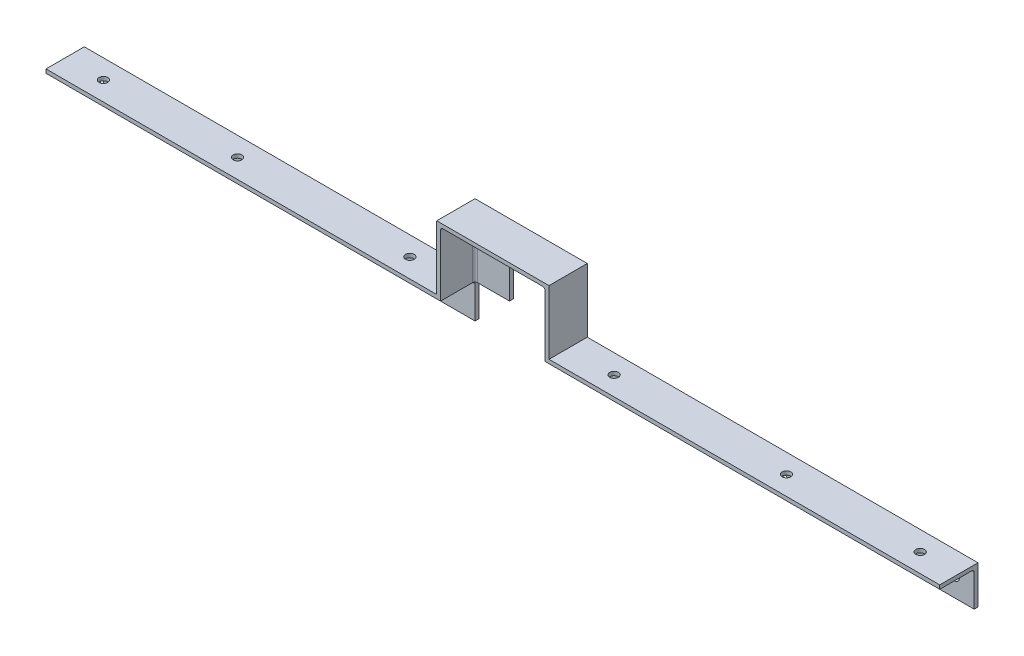
from build123d import *

# Parameters (mm, degrees)
BOSS_EXTRU_1_DEPTH      = 1.5
BOSS_EXTRU_2_DEPTH      = 13.5
D_GAGEMENT_M32_D        = 3.4
D_GAGEMENT_M32_DEPTH    = 10
D_GAGEMENT_M32_TIP      = 1.021463052
D_GAGEMENT_M31_D        = 3.4
D_GAGEMENT_M31_DEPTH    = 10
D_GAGEMENT_M31_TIP      = 1.021463052
ESQUISSE12_W            = 13.5
ESQUISSE12_H            = 13.5
ENL_V_MAT_EXTRU_1_DEPTH = 1.5
CONG_1_R                = 1
CONG_2_R                = 1
D_GAGEMENT_M33_D        = 3.4
D_GAGEMENT_M33_DEPTH    = 10
D_GAGEMENT_M33_TIP      = 1.021463052


# Some blends are built 0.0001 mm under size
with BuildPart() as part:
    # Esquisse2 → Boss.-Extru.1 (new body)
    with BuildSketch(Plane.XY.offset(1.5)):
        Polygon((-25.392437762, 124.305889048), (-178.410591433, 124.305889048), (-178.410591433, 149.305889048), (-222.374284091, 149.305889048), (-222.374284091, 124.305889048), (-375.392437762, 124.305889048), (-375.392437762, 109.305889048), (-207.374284091, 109.305889048), (-207.374284091, 134.305889048), (-193.410591433, 134.305889048), (-193.410591433, 109.305889048), (-25.392437762, 109.305889048), align=None)
    extrude(amount=BOSS_EXTRU_1_DEPTH)

    # Esquisse3 → Boss.-Extru.2 (add)
    with BuildSketch(Plane.XY.offset(3)):
        Polygon((-375.392437762, 122.805889048), (-220.874284091, 122.805889048), (-220.874284091, 147.805889048), (-179.910591433, 147.805889048), (-179.910591433, 122.805889048), (-25.392437762, 122.805889048), (-25.392437762, 124.305889048), (-178.410591433, 124.305889048), (-178.410591433, 149.305889048), (-222.374284091, 149.305889048), (-222.374284091, 124.305889048), (-375.392437762, 124.305889048), align=None)
    extrude(amount=BOSS_EXTRU_2_DEPTH)

    # Dégagement M32
    with Locations(Plane(origin=(-229.874284091, 116.805889048, 3), x_dir=(1, 0, 0), z_dir=(0, 0, 1))):
        with Locations((0, 0), (-70.518153671, 0), (-138.018153671, 0), (58.963692658, 0), (129.481846329, 0), (196.981846329, 0)):
            Hole(D_GAGEMENT_M32_D / 2, depth=D_GAGEMENT_M32_DEPTH)
            with Locations((0, 0, -(D_GAGEMENT_M32_DEPTH + D_GAGEMENT_M32_TIP / 2))):  # 118° drill point
                Cone(0, D_GAGEMENT_M32_D / 2, D_GAGEMENT_M32_TIP, mode=Mode.SUBTRACT)

    # Dégagement M31
    with Locations(Plane(origin=(-214.874284091, 137.305889048, 3), x_dir=(1, 0, 0), z_dir=(0, 0, 1))):
        with Locations((0, 0), (28.963692658, 0)):
            Hole(D_GAGEMENT_M31_D / 2, depth=D_GAGEMENT_M31_DEPTH)
            with Locations((0, 0, -(D_GAGEMENT_M31_DEPTH + D_GAGEMENT_M31_TIP / 2))):  # 118° drill point
                Cone(0, D_GAGEMENT_M31_D / 2, D_GAGEMENT_M31_TIP, mode=Mode.SUBTRACT)

    # Esquisse12 → Enlèv. mat.-Extru.1 (cut)
    with BuildSketch(Plane.XY.offset(3)):
        with Locations((-214.124284091, 116.055889048)):
            Rectangle(ESQUISSE12_W, ESQUISSE12_H)
        with Locations((-186.660591433, 116.055889048)):
            Rectangle(ESQUISSE12_W, ESQUISSE12_H)
    extrude(amount=-ENL_V_MAT_EXTRU_1_DEPTH, mode=Mode.SUBTRACT)

    # Congé1
    # the kernel refuses this fillet: 1 mm, written as the material it adds along each edge
    with BuildSketch(Plane(origin=(-179.910591433, 122.805889048, 3), x_dir=(0, -1, 0), z_dir=(1, 0, 0))) as cong_1_piece_1:
        with BuildLine():
            CenterArc((CONG_1_R, -CONG_1_R), CONG_1_R, 90, 90)
            Line((0, -CONG_1_R), (0, 0))
            Line((0, 0), (CONG_1_R, 0))
        make_face()
    extrude(amount=154.518153671)
    with BuildSketch(Plane(origin=(-223.374284091, 147.805889048, 3), x_dir=(0, 0, 1), z_dir=(1, 0, 0))) as cong_1_piece_2_section:
        with BuildLine():
            CenterArc((CONG_1_R, CONG_1_R), CONG_1_R, 180, 90)
            Line((0, CONG_1_R), (0, 0))
            Line((0, 0), (CONG_1_R, 0))
        make_face()
    cong_1_piece_2 = extrude(amount=43.463692658, mode=Mode.PRIVATE)
    cong_1_piece_2 = split(cong_1_piece_2, bisect_by=Plane(origin=(-222.374284091, 147.582521109, 3.223367939), z_dir=(1, 0, 0)), keep=Keep.TOP, mode=Mode.PRIVATE)
    add(cong_1_piece_2)
    with BuildSketch(Plane(origin=(-375.392437762, 122.805889048, 3), x_dir=(0, 0, 1), z_dir=(1, 0, 0))) as cong_1_piece_3:
        with BuildLine():
            CenterArc((CONG_1_R, CONG_1_R), CONG_1_R, 180, 90)
            Line((0, CONG_1_R), (0, 0))
            Line((0, 0), (CONG_1_R, 0))
        make_face()
    extrude(amount=154.518153671)

    # Congé2
    cong_2_edges = [part.edges().sort_by_distance(p)[0] for p in [
        (-179.910591433, 134.805889048, 3),
        (-179.910591433, 147.512995829, 3.292893219),
        (-220.874284091, 147.512995829, 3.292893219),
        (-220.874284091, 134.805889048, 3),
        (-220.874284091, 147.805889048, 10.25),
        (-179.910591433, 147.805889048, 10.25),
    ]]
    fillet(cong_2_edges, radius=CONG_2_R - 0.0001)  # a hair under: the kernel refuses the full size

    # Dégagement M33
    with Locations(Plane(origin=(-92.892437762, 124.305889048, 9), x_dir=(1, 0, 0), z_dir=(0, 1, 0))):
        with Locations((0, 0), (52.5, -0.151530772), (-67.5, 0), (-147.5, 0), (-215, 0), (-267.5, 0)):
            Hole(D_GAGEMENT_M33_D / 2, depth=D_GAGEMENT_M33_DEPTH)
            with Locations((0, 0, -(D_GAGEMENT_M33_DEPTH + D_GAGEMENT_M33_TIP / 2))):  # 118° drill point
                Cone(0, D_GAGEMENT_M33_D / 2, D_GAGEMENT_M33_TIP, mode=Mode.SUBTRACT)


solid = part.part
